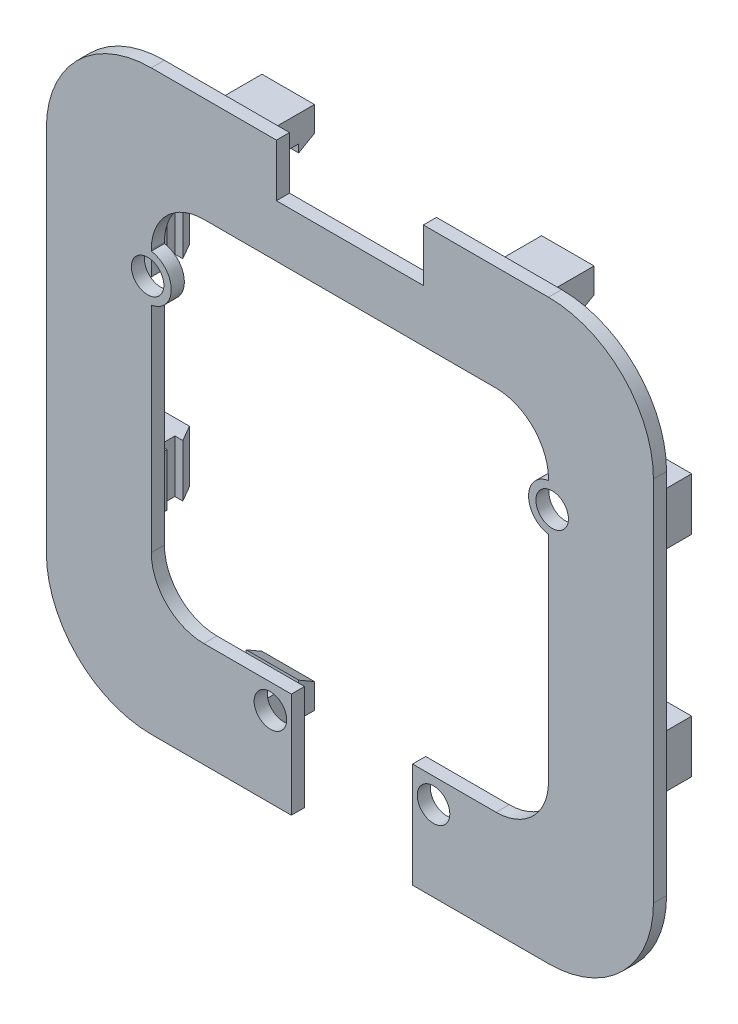
from build123d import *

# Parameters (mm, degrees)
CROQUIS1_R                  = 3.1
SALIENTE_EXTRUIR1_DEPTH     = 2.5
CROQUIS2_W                  = 6.5
CROQUIS2_H                  = 10
SALIENTE_EXTRUIR3_DEPTH     = 6
CROQUIS5_W                  = 1.5
CROQUIS5_H                  = 10
CORTAR_EXTRUIR2_DEPTH       = 3
SALIENTE_EXTRUIR4_START     = -3
CROQUIS6_W                  = 5
CROQUIS6_H                  = 10
SALIENTE_EXTRUIR4_DEPTH     = 4
REDONDEO1_R                 = 3
CROQUIS7_W                  = 6.5
CROQUIS7_H                  = 10
SALIENTE_EXTRUIR5_DEPTH     = 3
CHAFL_N1_SIZE2              = 3
CHAFL_N1_SIZE               = 1.732050808
CROQUIS8_W                  = 5
CROQUIS8_H                  = 10
SALIENTE_EXTRUIR6_DEPTH     = 3
CROQUIS9_W                  = 6.5
CROQUIS9_H                  = 10
SALIENTE_EXTRUIR7_DEPTH     = 3
REDONDEO2_R                 = 3
CHAFL_N2_SIZE2              = 3
CHAFL_N2_SIZE               = 1.732050808
REDONDEO1_OF_SIMETR_A1_R    = 3
CHAFL_N1_OF_SIMETR_A1_SIZE2 = 1.732050808
CHAFL_N1_OF_SIMETR_A1_SIZE  = 3
REDONDEO2_OF_SIMETR_A1_R    = 3
CHAFL_N2_OF_SIMETR_A1_SIZE2 = 1.732050808
CHAFL_N2_OF_SIMETR_A1_SIZE  = 3
CROQUIS10_W                 = 10
CROQUIS10_H                 = 6.5
SALIENTE_EXTRUIR9_DEPTH     = 6
CROQUIS12_W                 = 10
CROQUIS12_H                 = 1.5
CORTAR_EXTRUIR6_DEPTH       = 3
CROQUIS13_W                 = 10
CROQUIS13_H                 = 5
SALIENTE_EXTRUIR10_DEPTH    = 3
CROQUIS14_W                 = 10
CROQUIS14_H                 = 6.5
SALIENTE_EXTRUIR11_DEPTH    = 3
REDONDEO3_R                 = 3
CHAFL_N3_SIZE2              = 1.732050808
CHAFL_N3_SIZE               = 3
REDONDEO3_OF_SIMETR_A2_R    = 3
CHAFL_N3_OF_SIMETR_A2_SIZE2 = 3
CHAFL_N3_OF_SIMETR_A2_SIZE  = 1.732050808
SIMETR_A3_START             = 26.922069807
SIMETR_A3_DEPTH             = 10


# Read off the part's stored shape, not the designer's step: Simetría3
with BuildPart() as part:
    # Croquis1 → Saliente-Extruir1 (new body)
    with BuildSketch(Plane.XY):
        with BuildLine():
            Line((32.732069807, -35), (16.823581959, -35))
            Line((16.823581959, -35), (16.823581959, -55))
            Line((16.823581959, -55), (42.732069807, -55))
            ThreePointArc((42.732069807, -55), (56.874205431, -49.142135624), (62.732069807, -35))
            Line((62.732069807, -35), (62.732069807, 35))
            ThreePointArc((62.732069807, 35), (56.874205431, 49.142135624), (42.732069807, 55))
            Line((42.732069807, 55), (18.885856119, 55))
            Line((18.885856119, 55), (18.885856119, 45))
            Line((18.885856119, 45), (-9.114143881, 45))
            Line((-9.114143881, 45), (-9.114143881, 55))
            Line((-9.114143881, 55), (-32.96035757, 55))
            ThreePointArc((-32.96035757, 55), (-47.102493193, 49.142135624), (-52.96035757, 35))
            Line((-52.96035757, 35), (-52.96035757, -35))
            ThreePointArc((-52.96035757, -35), (-47.102493193, -49.142135624), (-32.96035757, -55))
            Line((-32.96035757, -55), (-6.267930193, -55))
            Line((-6.267930193, -55), (-6.267930193, -35))
            Line((-6.267930193, -35), (-22.96035757, -35))
            ThreePointArc((-22.96035757, -35), (-30.031425382, -32.071067812), (-32.96035757, -25))
            Line((-32.96035757, -25), (-32.96035757, 15.854777846))
            ThreePointArc((-32.96035757, 15.854777846), (-29.16035757, 20.3), (-32.96035757, 24.745222154))
            Line((-32.96035757, 24.745222154), (-32.96035757, 25))
            ThreePointArc((-32.96035757, 25), (-30.031425382, 32.071067812), (-22.96035757, 35))
            Line((-22.96035757, 35), (32.732069807, 35))
            ThreePointArc((32.732069807, 35), (39.803137619, 32.071067812), (42.732069807, 25))
            Line((42.732069807, 25), (42.732069807, 24.745222154))
            ThreePointArc((42.732069807, 24.745222154), (38.932069807, 20.3), (42.732069807, 15.854777846))
            Line((42.732069807, 15.854777846), (42.732069807, -25))
            ThreePointArc((42.732069807, -25), (39.803137619, -32.071067812), (32.732069807, -35))
        make_face()
        with Locations((20.823581959, -39.7)):
            Circle(CROQUIS1_R, mode=Mode.SUBTRACT)
        with Locations((-10.267930193, -39.7)):
            Circle(CROQUIS1_R, mode=Mode.SUBTRACT)
        with Locations((43.432069807, 20.3)):
            Circle(CROQUIS1_R, mode=Mode.SUBTRACT)
        with Locations((-33.66035757, 20.3)):
            Circle(CROQUIS1_R, mode=Mode.SUBTRACT)
    extrude(amount=SALIENTE_EXTRUIR1_DEPTH)

    # Croquis2 → Saliente-Extruir3 (add)
    with BuildSketch(Plane(origin=(0, 0, 0), x_dir=(-1, 0, 0), z_dir=(0, 0, -1))):
        with Locations((41.71035757, -20)):
            Rectangle(CROQUIS2_W, CROQUIS2_H)
        with Locations((41.71035757, 20)):
            Rectangle(CROQUIS2_W, CROQUIS2_H)
    saliente_extruir3 = extrude(amount=SALIENTE_EXTRUIR3_DEPTH)

    # Croquis5 → Cortar-Extruir2 (cut)
    with BuildSketch(Plane(origin=(0, 0, 0), x_dir=(-1, 0, 0), z_dir=(0, 0, -1))):
        with Locations((39.21035757, -20)):
            Rectangle(CROQUIS5_W, CROQUIS5_H)
        with Locations((39.21035757, 20)):
            Rectangle(CROQUIS5_W, CROQUIS5_H)
    cortar_extruir2 = extrude(amount=CORTAR_EXTRUIR2_DEPTH, mode=Mode.SUBTRACT)

    # Croquis6 → Saliente-Extruir4 (add)
    with BuildSketch(Plane(origin=(-38.46035757, 25, -6), x_dir=(1, 0, 0), z_dir=(0, 0, 1)).offset(SALIENTE_EXTRUIR4_START)):
        with Locations((-4, -5)):
            Rectangle(CROQUIS6_W, CROQUIS6_H)
    saliente_extruir4 = extrude(amount=SALIENTE_EXTRUIR4_DEPTH)

    # Redondeo1
    redondeo1_edges = [part.edges().sort_by_distance(p)[0] for p in [
        (-44.96035757, 20, 0),
    ]]
    fillet(redondeo1_edges, radius=REDONDEO1_R)

    # Croquis7 → Saliente-Extruir5 (add)
    with BuildSketch(Plane(origin=(0, 0, -9), x_dir=(-1, 0, 0), z_dir=(0, 0, -1))):
        with Locations((41.71035757, 20)):
            Rectangle(CROQUIS7_W, CROQUIS7_H)
    saliente_extruir5 = extrude(amount=SALIENTE_EXTRUIR5_DEPTH)

    # Chaflán1
    chafl_n1_edges = [part.edges().sort_by_distance(p)[0] for p in [
        (-38.46035757, 20, -12),
    ]]
    chafl_n1_side = [part.faces().sort_by_distance(p)[0] for p in [
        (-38.494998586, 20, -12),
    ]]
    chamfer(chafl_n1_edges, length=CHAFL_N1_SIZE - 0.0001, length2=CHAFL_N1_SIZE2 - 0.0001, reference=chafl_n1_side[0])  # a hair under: the kernel refuses the full size

    # Croquis8 → Saliente-Extruir6 (add)
    with BuildSketch(Plane(origin=(0, 0, -6), x_dir=(-1, 0, 0), z_dir=(0, 0, -1))):
        with Locations((42.46035757, -20)):
            Rectangle(CROQUIS8_W, CROQUIS8_H)
    saliente_extruir6 = extrude(amount=SALIENTE_EXTRUIR6_DEPTH)

    # Croquis9 → Saliente-Extruir7 (add)
    with BuildSketch(Plane(origin=(0, 0, -9), x_dir=(-1, 0, 0), z_dir=(0, 0, -1))):
        with Locations((41.71035757, -20)):
            Rectangle(CROQUIS9_W, CROQUIS9_H)
    saliente_extruir7 = extrude(amount=SALIENTE_EXTRUIR7_DEPTH)

    # Redondeo2
    redondeo2_edges = [part.edges().sort_by_distance(p)[0] for p in [
        (-44.96035757, -20, 0),
    ]]
    fillet(redondeo2_edges, radius=REDONDEO2_R)

    # Chaflán2
    chafl_n2_edges = [part.edges().sort_by_distance(p)[0] for p in [
        (-38.46035757, -20, -12),
    ]]
    chafl_n2_side = [part.faces().sort_by_distance(p)[0] for p in [
        (-38.494998586, -20, -12),
    ]]
    chamfer(chafl_n2_edges, length=CHAFL_N2_SIZE - 0.0001, length2=CHAFL_N2_SIZE2 - 0.0001, reference=chafl_n2_side[0])  # a hair under: the kernel refuses the full size

    # Simetría1: Saliente-Extruir3, Cortar-Extruir2, Saliente-Extruir4, Saliente-Extruir5, Saliente-Extruir6, Saliente-Extruir7 across plane
    add(saliente_extruir3.mirror(Plane(origin=(5.277069807, 0, 0), x_dir=(0, 0, 1), z_dir=(1, 0, 0))))
    add(cortar_extruir2.mirror(Plane(origin=(5.277069807, 0, 0), x_dir=(0, 0, 1), z_dir=(1, 0, 0))), mode=Mode.SUBTRACT)
    add(saliente_extruir4.mirror(Plane(origin=(5.277069807, 0, 0), x_dir=(0, 0, 1), z_dir=(1, 0, 0))))
    add(saliente_extruir5.mirror(Plane(origin=(5.277069807, 0, 0), x_dir=(0, 0, 1), z_dir=(1, 0, 0))))
    add(saliente_extruir6.mirror(Plane(origin=(5.277069807, 0, 0), x_dir=(0, 0, 1), z_dir=(1, 0, 0))))
    add(saliente_extruir7.mirror(Plane(origin=(5.277069807, 0, 0), x_dir=(0, 0, 1), z_dir=(1, 0, 0))))

    # Redondeo1 of Simetría1
    redondeo1_of_simetr_a1_edges = [part.edges().sort_by_distance(p)[0] for p in [
        (55.514497184, 20, 0),
    ]]
    fillet(redondeo1_of_simetr_a1_edges, radius=REDONDEO1_OF_SIMETR_A1_R)

    # Chaflán1 of Simetría1
    chafl_n1_of_simetr_a1_edges = [part.edges().sort_by_distance(p)[0] for p in [
        (49.014497184, 20, -12),
    ]]
    chafl_n1_of_simetr_a1_side = [part.faces().sort_by_distance(p)[0] for p in [
        (49.014497184, 20, -11.965358984),
    ]]
    chamfer(chafl_n1_of_simetr_a1_edges, length=CHAFL_N1_OF_SIMETR_A1_SIZE - 0.0001, length2=CHAFL_N1_OF_SIMETR_A1_SIZE2 - 0.0001, reference=chafl_n1_of_simetr_a1_side[0])  # a hair under: the kernel refuses the full size

    # Redondeo2 of Simetría1
    redondeo2_of_simetr_a1_edges = [part.edges().sort_by_distance(p)[0] for p in [
        (55.514497184, -20, 0),
    ]]
    fillet(redondeo2_of_simetr_a1_edges, radius=REDONDEO2_OF_SIMETR_A1_R)

    # Chaflán2 of Simetría1
    chafl_n2_of_simetr_a1_edges = [part.edges().sort_by_distance(p)[0] for p in [
        (49.014497184, -20, -12),
    ]]
    chafl_n2_of_simetr_a1_side = [part.faces().sort_by_distance(p)[0] for p in [
        (49.014497184, -20, -11.965358984),
    ]]
    chamfer(chafl_n2_of_simetr_a1_edges, length=CHAFL_N2_OF_SIMETR_A1_SIZE - 0.0001, length2=CHAFL_N2_OF_SIMETR_A1_SIZE2 - 0.0001, reference=chafl_n2_of_simetr_a1_side[0])  # a hair under: the kernel refuses the full size

    # Croquis10 → Saliente-Extruir9 (add)
    with BuildSketch(Plane(origin=(0, 0, 0), x_dir=(-1, 0, 0), z_dir=(0, 0, -1))):
        with Locations((21.367930193, -46.75)):
            Rectangle(CROQUIS10_W, CROQUIS10_H)
    saliente_extruir9 = extrude(amount=SALIENTE_EXTRUIR9_DEPTH)

    # Croquis12 → Cortar-Extruir6 (cut)
    with BuildSketch(Plane(origin=(0, 0, 0), x_dir=(-1, 0, 0), z_dir=(0, 0, -1))):
        with Locations((21.367930193, -44.25)):
            Rectangle(CROQUIS12_W, CROQUIS12_H)
    cortar_extruir6 = extrude(amount=CORTAR_EXTRUIR6_DEPTH, mode=Mode.SUBTRACT)

    # Croquis13 → Saliente-Extruir10 (add)
    with BuildSketch(Plane(origin=(0, 0, -6), x_dir=(-1, 0, 0), z_dir=(0, 0, -1))):
        with Locations((21.367930193, -47.5)):
            Rectangle(CROQUIS13_W, CROQUIS13_H)
    saliente_extruir10 = extrude(amount=SALIENTE_EXTRUIR10_DEPTH)

    # Croquis14 → Saliente-Extruir11 (add)
    with BuildSketch(Plane(origin=(0, 0, -9), x_dir=(-1, 0, 0), z_dir=(0, 0, -1))):
        with Locations((21.367930193, -46.75)):
            Rectangle(CROQUIS14_W, CROQUIS14_H)
    saliente_extruir11 = extrude(amount=SALIENTE_EXTRUIR11_DEPTH)

    # Redondeo3
    redondeo3_edges = [part.edges().sort_by_distance(p)[0] for p in [
        (-21.367930193, -50, 0),
    ]]
    fillet(redondeo3_edges, radius=REDONDEO3_R)

    # Chaflán3
    chafl_n3_edges = [part.edges().sort_by_distance(p)[0] for p in [
        (-21.367930193, -43.5, -12),
    ]]
    chafl_n3_side = [part.faces().sort_by_distance(p)[0] for p in [
        (-21.367930193, -43.5, -11.965358984),
    ]]
    chamfer(chafl_n3_edges, length=CHAFL_N3_SIZE - 0.0001, length2=CHAFL_N3_SIZE2 - 0.0001, reference=chafl_n3_side[0])  # a hair under: the kernel refuses the full size

    # Simetría2: Saliente-Extruir9, Cortar-Extruir6, Saliente-Extruir10, Saliente-Extruir11 across plane
    add(saliente_extruir9.mirror(Plane.ZX))
    add(cortar_extruir6.mirror(Plane.ZX), mode=Mode.SUBTRACT)
    add(saliente_extruir10.mirror(Plane.ZX))
    add(saliente_extruir11.mirror(Plane.ZX))

    # Redondeo3 of Simetría2
    redondeo3_of_simetr_a2_edges = [part.edges().sort_by_distance(p)[0] for p in [
        (-21.367930193, 50, 0),
    ]]
    fillet(redondeo3_of_simetr_a2_edges, radius=REDONDEO3_OF_SIMETR_A2_R)

    # Chaflán3 of Simetría2
    chafl_n3_of_simetr_a2_edges = [part.edges().sort_by_distance(p)[0] for p in [
        (-21.367930193, 43.5, -12),
    ]]
    chafl_n3_of_simetr_a2_side = [part.faces().sort_by_distance(p)[0] for p in [
        (-21.367930193, 43.534641016, -12),
    ]]
    chamfer(chafl_n3_of_simetr_a2_edges, length=CHAFL_N3_OF_SIMETR_A2_SIZE - 0.0001, length2=CHAFL_N3_OF_SIMETR_A2_SIZE2 - 0.0001, reference=chafl_n3_of_simetr_a2_side[0])  # a hair under: the kernel refuses the full size

    # Simetría3 outline → Simetría3 (add)
    with BuildSketch(Plane.YZ.offset(SIMETR_A3_START)):
        with BuildLine():
            Line((-45, -3), (-45, 0))
            Line((-45, 0), (-53, 0))
            ThreePointArc((-53, 0), (-50.878679656, -0.878679656), (-50, -3))
            Line((-50, -3), (-50, -12))
            Line((-50, -12), (-45.232050808, -12))
            Line((-45.232050808, -12), (-43.5, -9))
            Line((-43.5, -9), (-45, -9))
            Line((-45, -9), (-45, -6))
            Line((-45, -6), (-43.5, -6))
            Line((-43.5, -6), (-43.5, -3))
            Line((-43.5, -3), (-45, -3))
        make_face()
        with BuildLine():
            Line((43.5, -6), (45, -6))
            Line((45, -6), (45, -9))
            Line((45, -9), (43.5, -9))
            Line((43.5, -9), (45.232050808, -12))
            Line((45.232050808, -12), (50, -12))
            Line((50, -12), (50, -3))
            ThreePointArc((50, -3), (50.878679656, -0.878679656), (53, 0))
            Line((53, 0), (45, 0))
            Line((45, 0), (45, -3))
            Line((45, -3), (43.5, -3))
            Line((43.5, -3), (43.5, -6))
        make_face()
    extrude(amount=SIMETR_A3_DEPTH)


solid = part.part
